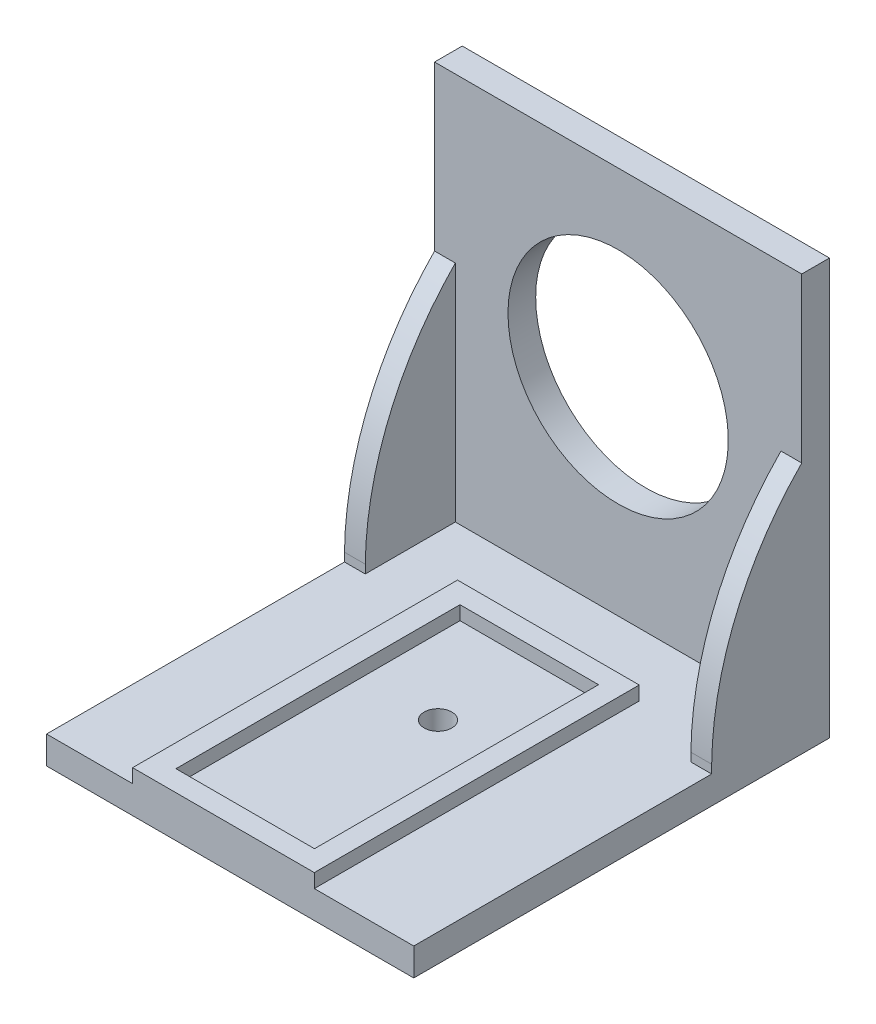
from build123d import *

# Parameters (mm, degrees)
ESBO_O1_W                  = 53
ESBO_O1_H                  = 60
RESSALTO_EXTRUS_O1_DEPTH   = 4
ESBO_O2_W                  = 53
ESBO_O2_H                  = 4
RESSALTO_EXTRUS_O2_DEPTH   = 60
ESBO_O5_W                  = 3
ESBO_O5_H                  = 36.373853852
RESSALTO_EXTRUS_O3_DEPTH   = 17
CORTE_EXTRUS_O3_DEPTH      = 62
CORTE_EXTRUS_O3_DEPTH_BACK = 15
ESBO_O7_W                  = 26.228570329
ESBO_O7_H                  = 46.898944641
ESBO_O7_W_2                = 20
ESBO_O7_H_2                = 41
RESSALTO_EXTRUS_O4_DEPTH   = 6
CORTE_EXTRUS_O4_DEPTH      = 10
CORTE_EXTRUS_O4_DEPTH_BACK = 21
ESBO_O8_R                  = 2
CORTE_EXTRUS_O6_DEPTH      = 45
CORTE_EXTRUS_O6_DEPTH_BACK = 37
ESBO_O9_R                  = 15.9


with BuildPart() as part:
    # Esboço1 → Ressalto-extrusão1 (new body)
    with BuildSketch(Plane.XY):
        with Locations((26.5, 30)):
            Rectangle(ESBO_O1_W, ESBO_O1_H)
    extrude(amount=RESSALTO_EXTRUS_O1_DEPTH)

    # Esboço2 → Ressalto-extrusão2 (add)
    with BuildSketch(Plane.XY):
        with Locations((26.5, 2)):
            Rectangle(ESBO_O2_W, ESBO_O2_H)
    extrude(amount=RESSALTO_EXTRUS_O2_DEPTH)

    # Esboço5 → Ressalto-extrusão3 (add)
    with BuildSketch(Plane.XY):
        with Locations((1.5, 18.186926926)):
            Rectangle(ESBO_O5_W, ESBO_O5_H)
        with Locations((51.5, 18.186926926)):
            Rectangle(ESBO_O5_W, ESBO_O5_H)
    extrude(amount=RESSALTO_EXTRUS_O3_DEPTH)

    # Esboço6 → Corte-extrusão3 (cut, two sides: drawn at the far end of the back side and taken through both)
    with BuildSketch(Plane(origin=(0, 0, 0), x_dir=(0, 0, -1), z_dir=(1, 0, 0)).offset(-CORTE_EXTRUS_O3_DEPTH_BACK)):
        with BuildLine():
            ThreePointArc((-17, 5.226597996), (-13.510052949, 22.056538471), (-4, 36.373853852))
            Line((-4, 36.373853852), (-17, 36.373853852))
            Line((-17, 36.373853852), (-17, 5.226597996))
        make_face()
    extrude(amount=CORTE_EXTRUS_O3_DEPTH + CORTE_EXTRUS_O3_DEPTH_BACK, mode=Mode.SUBTRACT)

    # Esboço7 → Ressalto-extrusão4 (add)
    with BuildSketch(Plane(origin=(0, 0, 0), x_dir=(1, 0, 0), z_dir=(0, 1, 0))):
        with Locations((25.531831297, -36.55052768)):
            Rectangle(ESBO_O7_W, ESBO_O7_H)
        with Locations((25.674113589, -36.5)):
            Rectangle(ESBO_O7_W_2, ESBO_O7_H_2, mode=Mode.SUBTRACT)
    extrude(amount=RESSALTO_EXTRUS_O4_DEPTH)

    # Esboço8 → Corte-extrusão4 (cut, two sides: drawn at the far end of the back side and taken through both)
    with BuildSketch(Plane(origin=(0, 0, 0), x_dir=(1, 0, 0), z_dir=(0, 1, 0)).offset(-CORTE_EXTRUS_O4_DEPTH_BACK)):
        with Locations((26.5, -30)):
            Circle(ESBO_O8_R)
    extrude(amount=CORTE_EXTRUS_O4_DEPTH + CORTE_EXTRUS_O4_DEPTH_BACK, mode=Mode.SUBTRACT)

    # Esboço9 → Corte-extrusão6 (cut, two sides: drawn at the far end of the back side and taken through both)
    with BuildSketch(Plane.XY.offset(-CORTE_EXTRUS_O6_DEPTH_BACK)):
        with Locations((26.5, 33.9)):
            Circle(ESBO_O9_R)
    extrude(amount=CORTE_EXTRUS_O6_DEPTH + CORTE_EXTRUS_O6_DEPTH_BACK, mode=Mode.SUBTRACT)


solid = part.part
